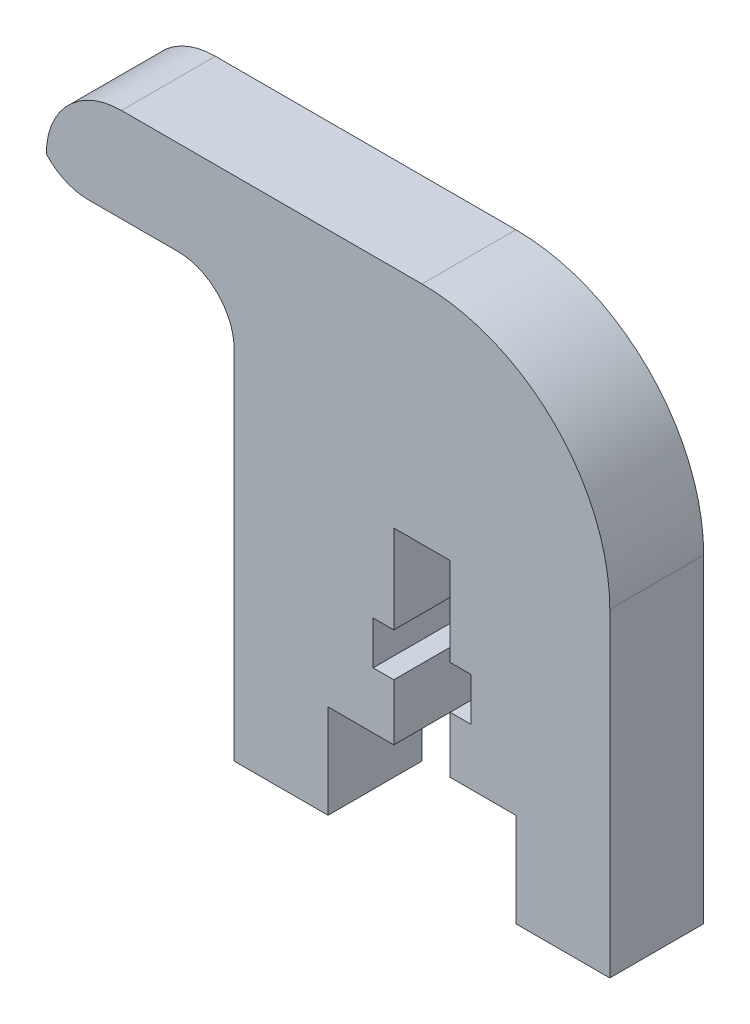
from build123d import *

# Parameters (mm, degrees)
BOSS_EXTRUDE1_DEPTH = 5
FILLET1_R           = 10
FILLET2_R           = 4
FILLET3_R           = 3


with BuildPart() as part:
    # Sketch1 → Boss-Extrude1 (new body)
    with BuildSketch(Plane.XY):
        Polygon((-24.942517195, 5), (-28.442517195, 5), (-28.442517195, 0), (-33.442517195, 0), (-33.442517195, 5), (-33.442517195, 22), (-43.442517195, 22), (-43.442517195, 27), (-13.442517195, 27), (-13.442517195, 5), (-13.442517195, 0), (-18.442517195, 0), (-18.442517195, 5), (-21.942517195, 5), (-21.942517195, 8), (-20.842517195, 8), (-20.842517195, 10.3), (-21.942517195, 10.3), (-21.942517195, 15), (-24.942517195, 15), (-24.942517195, 10.3), (-26.042517195, 10.3), (-26.042517195, 8), (-24.942517195, 8), align=None)
    extrude(amount=BOSS_EXTRUDE1_DEPTH)

    # Fillet1
    fillet1_edges = [part.edges().sort_by_distance(p)[0] for p in [
        (-13.442517195, 27, 2.5),
    ]]
    fillet(fillet1_edges, radius=FILLET1_R)

    # Fillet2
    fillet2_edges = [part.edges().sort_by_distance(p)[0] for p in [
        (-43.442517195, 27, 2.5),
    ]]
    fillet(fillet2_edges, radius=FILLET2_R)

    # Fillet3
    # the kernel refuses this fillet: 3 mm, written as the material it adds along each edge
    with BuildSketch(Plane(origin=(-33.442517195, 22, 0), x_dir=(-1, 0, 0), z_dir=(0, 0, 1))) as fillet3_piece_1:
        with BuildLine():
            CenterArc((FILLET3_R, FILLET3_R), FILLET3_R, 180, 90)
            Line((0, FILLET3_R), (0, 0))
            Line((0, 0), (FILLET3_R, 0))
        make_face()
    extrude(amount=5)
    # the kernel refuses this fillet: 3 mm, written as the material it takes off along each edge
    with BuildSketch(Plane(origin=(-43.442517195, 22, -5.590169944), x_dir=(0, 1, 0), z_dir=(0, 0, 1))) as fillet3_2_piece_1:
        with BuildLine():
            CenterArc((3, -2.236067977), FILLET3_R, 131.810314896, 48.189685104)
            Line((0, -2.236067977), (0, 0))
            Line((0, 0), (1, 0))
        make_face()
    extrude(amount=16.180339887, mode=Mode.SUBTRACT)


solid = part.part
